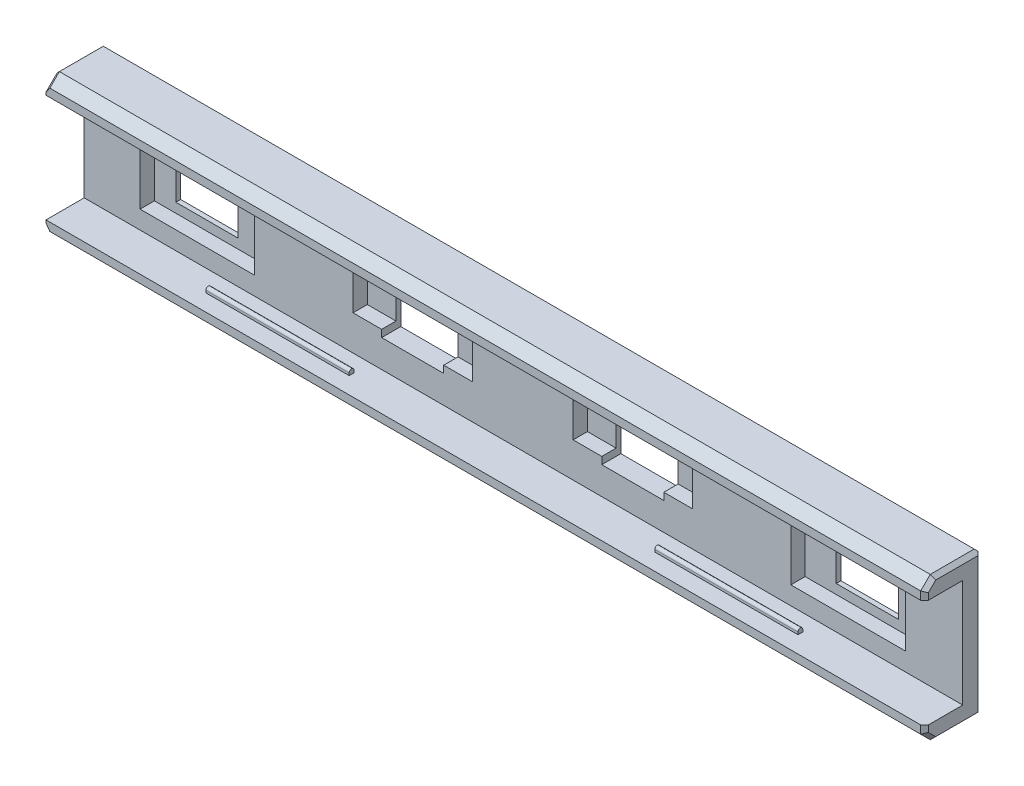
from build123d import *

# Parameters (mm, degrees)
SKETCH1_W               = 92
SKETCH1_H               = 15
BOSS_EXTRUDE1_DEPTH     = 6
CUT_EXTRUDE1_DEPTH      = 54.227863457
CUT_EXTRUDE1_DEPTH_BACK = 54.227863457
SKETCH2_W               = 6.5
SKETCH2_H               = 5.5
CUT_EXTRUDE2_DEPTH      = 54.227863457
CUT_EXTRUDE2_DEPTH_BACK = 54.227863457
SKETCH3_W               = 6.5
SKETCH3_H               = 5.5
CUT_EXTRUDE3_DEPTH      = 54.227863457
CUT_EXTRUDE3_DEPTH_BACK = 54.227863457
SKETCH4_W               = 6.5
SKETCH4_H               = 5.5
CUT_EXTRUDE4_DEPTH      = 54.227863457
CUT_EXTRUDE4_DEPTH_BACK = 54.227863457
SKETCH5_W               = 6.5
SKETCH5_H               = 5.5
CUT_EXTRUDE5_DEPTH      = 54.227863457
CUT_EXTRUDE5_DEPTH_BACK = 4
SKETCH8_W               = 92
SKETCH8_H               = 11.3
SKETCH9_W               = 12
SKETCH9_H               = 7.5
CUT_EXTRUDE6_DEPTH      = 1.5
SKETCH10_W              = 12.5
SKETCH10_H              = 4
CUT_EXTRUDE7_DEPTH      = 1.5
CUT_EXTRUDE8_DEPTH      = 92
SKETCH13_W              = 0.5
SKETCH13_H              = 10
CUT_EXTRUDE9_DEPTH      = 0.6
FILLET1_R               = 0.25
FILLET2_R               = 0.25
SKETCH16_W              = 15
SKETCH16_H              = 0.5
BOSS_EXTRUDE2_DEPTH     = 0.75
FILLET3_R               = 0.5
FILLET4_R               = 0.25
SKETCH17_W              = 15
SKETCH17_H              = 0.5
BOSS_EXTRUDE3_DEPTH     = 0.75
FILLET5_R               = 0.5
FILLET6_R               = 0.25
LPATTERN1_COUNT         = 2
LPATTERN1_PITCH         = 47
LPATTERN2_COUNT         = 2
LPATTERN2_PITCH         = 47
FILLET7_R               = 0.5
FILLET8_R               = 0.25
FILLET9_R               = 0.5
FILLET10_R              = 0.25
CHAMFER1_SIZE           = 0.4
CHAMFER2_SIZE           = 0.4
CHAMFER3_SIZE           = 0.4
CHAMFER4_SIZE           = 0.4
CHAMFER5_SIZE           = 0.4


# Some blends are built 0.0001 mm under size
with BuildPart() as part:
    # Sketch1 → Boss-Extrude1 (new body)
    with BuildSketch(Plane.XY):
        with Locations((0.25, 18.154296875)):
            Rectangle(SKETCH1_W, SKETCH1_H)
    extrude(amount=BOSS_EXTRUDE1_DEPTH)

    # Sketch2 → Cut-Extrude1 (cut, two sides: drawn at the far end of the back side and taken through both)
    with BuildSketch(Plane.XY.offset(6).offset(-CUT_EXTRUDE1_DEPTH_BACK)):
        with Locations((-34.4, 18.154296875)):
            Rectangle(SKETCH2_W, SKETCH2_H)
    extrude(amount=CUT_EXTRUDE1_DEPTH + CUT_EXTRUDE1_DEPTH_BACK, mode=Mode.SUBTRACT)

    # Sketch3 → Cut-Extrude2 (cut, two sides: drawn at the far end of the back side and taken through both)
    with BuildSketch(Plane.XY.offset(6).offset(-CUT_EXTRUDE2_DEPTH_BACK)):
        with Locations((-11.35, 18.154296875)):
            Rectangle(SKETCH3_W, SKETCH3_H)
    extrude(amount=CUT_EXTRUDE2_DEPTH + CUT_EXTRUDE2_DEPTH_BACK, mode=Mode.SUBTRACT)

    # Sketch4 → Cut-Extrude3 (cut, two sides: drawn at the far end of the back side and taken through both)
    with BuildSketch(Plane.XY.offset(6).offset(-CUT_EXTRUDE3_DEPTH_BACK)):
        with Locations((11.7, 18.154296875)):
            Rectangle(SKETCH4_W, SKETCH4_H)
    extrude(amount=CUT_EXTRUDE3_DEPTH + CUT_EXTRUDE3_DEPTH_BACK, mode=Mode.SUBTRACT)

    # Sketch5 → Cut-Extrude4 (cut, two sides: drawn at the far end of the back side and taken through both)
    with BuildSketch(Plane.XY.offset(6).offset(-CUT_EXTRUDE4_DEPTH_BACK)):
        with Locations((34.75, 18.154296875)):
            Rectangle(SKETCH5_W, SKETCH5_H)
    extrude(amount=CUT_EXTRUDE4_DEPTH + CUT_EXTRUDE4_DEPTH_BACK, mode=Mode.SUBTRACT)

    # Sketch8 → Cut-Extrude5 (cut, two sides: drawn at the far end of the back side and taken through both)
    with BuildSketch(Plane.XY.offset(6).offset(-CUT_EXTRUDE5_DEPTH_BACK)):
        with Locations((0.25, 18.154296875)):
            Rectangle(SKETCH8_W, SKETCH8_H)
    extrude(amount=CUT_EXTRUDE5_DEPTH + CUT_EXTRUDE5_DEPTH_BACK, mode=Mode.SUBTRACT)

    # Sketch9 → Cut-Extrude6 (cut)
    with BuildSketch(Plane.XY.offset(2)):
        with Locations((34.25, 18.154296875)):
            Rectangle(SKETCH9_W, SKETCH9_H)
        with Locations((-33.9, 18.154296875)):
            Rectangle(SKETCH9_W, SKETCH9_H)
    extrude(amount=-CUT_EXTRUDE6_DEPTH, mode=Mode.SUBTRACT)

    # Sketch10 → Cut-Extrude7 (cut)
    with BuildSketch(Plane.XY.offset(2)):
        with Locations((11.7, 18.154296875)):
            Rectangle(SKETCH10_W, SKETCH10_H)
        with Locations((-11.35, 18.154296875)):
            Rectangle(SKETCH10_W, SKETCH10_H)
    extrude(amount=-CUT_EXTRUDE7_DEPTH, mode=Mode.SUBTRACT)

    # Sketch12 → Cut-Extrude8 (cut)
    with BuildSketch(Plane(origin=(46.25, 0, 0), x_dir=(0, 0, -1), z_dir=(1, 0, 0))):
        Polygon((-6, 25.654296875), (-6, 24.654296875), (-5, 25.654296875), align=None)
        Polygon((-6, 10.654296875), (-5, 10.654296875), (-6, 11.654296875), align=None)
    extrude(amount=-CUT_EXTRUDE8_DEPTH, mode=Mode.SUBTRACT)

    # Sketch13 → Cut-Extrude9 (cut)
    with BuildSketch(Plane(origin=(0, 0, 0), x_dir=(-1, 0, 0), z_dir=(0, 0, -1))):
        with Locations((43.5, 18.154296875)):
            Rectangle(SKETCH13_W, SKETCH13_H)
    extrude(amount=-CUT_EXTRUDE9_DEPTH, mode=Mode.SUBTRACT)

    # Fillet1
    fillet1_edges = [part.edges().sort_by_distance(p)[0] for p in [
        (-43.75, 18.154296875, 0),
    ]]
    fillet(fillet1_edges, radius=FILLET1_R)

    # Fillet2
    fillet2_edges = [part.edges().sort_by_distance(p)[0] for p in [
        (-43.25, 18.154296875, 0.6),
        (-43.5, 23.154296875, 0.6),
        (-43.75, 18.154296875, 0.6),
        (-43.5, 13.154296875, 0.6),
    ]]
    fillet(fillet2_edges, radius=FILLET2_R - 0.0001)  # a hair under: the kernel refuses the full size

    # Sketch16 → Boss-Extrude2 (add)
    with BuildSketch(Plane.XZ.offset(-23.804296875)):
        with Locations((-23.25, 4)):
            Rectangle(SKETCH16_W, SKETCH16_H)
    boss_extrude2 = extrude(amount=BOSS_EXTRUDE2_DEPTH)

    # Fillet3
    fillet3_edges = [part.edges().sort_by_distance(p)[0] for p in [
        (-23.25, 23.054296875, 4.25),
    ]]
    fillet(fillet3_edges, radius=FILLET3_R - 0.0001)  # a hair under: the kernel refuses the full size

    # Fillet4
    # the kernel refuses this fillet: 0.25 mm, written as the material it takes off along each edge
    with BuildSketch(Plane(origin=(-32.517583767, 23.054296875, 3.75), x_dir=(0, 0.707033489959235, 0.7071800648180521), z_dir=(1, 0, 0))) as fillet4_piece_1:
        with BuildLine():
            CenterArc((0.530239774, -0.176759657), FILLET4_R, 44.994478066, 179.999583566)
            Line((0.353444757, -0.35351803), (0.335765256, -0.371193867))
            Line((0.335765256, -0.371193867), (-0.017679502, -0.017675837))
            Line((-0.017679502, -0.017675837), (-0.017675837, 0.017679502))
            ThreePointArc((-0.017675837, 0.017679502), (-0.017605119, 0.017750205), (0.724712878, 0.017675966))
            Line((0.724712878, 0.017675966), (0.707033505, 0))
        make_face()
    extrude(amount=18.535167534, mode=Mode.SUBTRACT)

    # Sketch17 → Boss-Extrude3 (add)
    with BuildSketch(Plane(origin=(0, 12.504296875, 0), x_dir=(1, 0, 0), z_dir=(0, 1, 0))):
        with Locations((-23.25, -4)):
            Rectangle(SKETCH17_W, SKETCH17_H)
    boss_extrude3 = extrude(amount=BOSS_EXTRUDE3_DEPTH)

    # Fillet5
    fillet5_edges = [part.edges().sort_by_distance(p)[0] for p in [
        (-23.25, 13.254296875, 4.25),
    ]]
    fillet(fillet5_edges, radius=FILLET5_R - 0.0001)  # a hair under: the kernel refuses the full size

    # Fillet6
    # the kernel refuses this fillet: 0.25 mm, written as the material it takes off along each edge
    with BuildSketch(Plane(origin=(-13.982416233, 13.254296875, 3.75), x_dir=(0, -0.7070334915471351, 0.7071800632304811), z_dir=(-1, 0, 0))) as fillet6_piece_1:
        with BuildLine():
            CenterArc((0.530239775, -0.176759657), FILLET6_R, 44.994477938, 179.999583823)
            Line((0.353444759, -0.35351803), (0.335765257, -0.371193867))
            Line((0.335765257, -0.371193867), (-0.017679502, -0.017675837))
            Line((-0.017679502, -0.017675837), (-0.017675837, 0.017679502))
            ThreePointArc((-0.017675837, 0.017679502), (-0.017605119, 0.017750205), (0.72471288, 0.017675966))
            Line((0.72471288, 0.017675966), (0.707033507, 0))
        make_face()
    extrude(amount=18.535167534, mode=Mode.SUBTRACT)

    # LPattern1: Boss-Extrude3 ×2
    with Locations(*[(i * LPATTERN1_PITCH, 0, 0) for i in range(1, LPATTERN1_COUNT)]):
        add(boss_extrude3)

    # LPattern2: Boss-Extrude2 ×2
    with Locations(*[(i * LPATTERN2_PITCH, 0, 0) for i in range(1, LPATTERN2_COUNT)]):
        add(boss_extrude2)

    # Fillet7
    fillet7_edges = [part.edges().sort_by_distance(p)[0] for p in [
        (23.75, 23.054296875, 4.25),
    ]]
    fillet(fillet7_edges, radius=FILLET7_R - 0.0001)  # a hair under: the kernel refuses the full size

    # Fillet8
    # the kernel refuses this fillet: 0.25 mm, written as the material it takes off along each edge
    with BuildSketch(Plane(origin=(14.482416233, 23.054296875, 3.75), x_dir=(0, 0.707033489959235, 0.7071800648180521), z_dir=(1, 0, 0))) as fillet8_piece_1:
        with BuildLine():
            CenterArc((0.530239774, -0.176759657), FILLET8_R, 44.994478066, 179.999583566)
            Line((0.353444757, -0.35351803), (0.335765256, -0.371193867))
            Line((0.335765256, -0.371193867), (-0.017679502, -0.017675837))
            Line((-0.017679502, -0.017675837), (-0.017675837, 0.017679502))
            ThreePointArc((-0.017675837, 0.017679502), (-0.017605119, 0.017750205), (0.724712878, 0.017675966))
            Line((0.724712878, 0.017675966), (0.707033505, 0))
        make_face()
    extrude(amount=18.535167534, mode=Mode.SUBTRACT)

    # Fillet9
    fillet9_edges = [part.edges().sort_by_distance(p)[0] for p in [
        (23.75, 13.254296875, 4.25),
    ]]
    fillet(fillet9_edges, radius=FILLET9_R - 0.0001)  # a hair under: the kernel refuses the full size

    # Fillet10
    # the kernel refuses this fillet: 0.25 mm, written as the material it takes off along each edge
    with BuildSketch(Plane(origin=(33.017583767, 13.254296875, 3.75), x_dir=(0, -0.7070334947010828, 0.707180060077187), z_dir=(-1, 0, 0))) as fillet10_piece_1:
        with BuildLine():
            CenterArc((0.530239777, -0.176759656), FILLET10_R, 44.994477682, 179.999584334)
            Line((0.353444762, -0.35351803), (0.335765261, -0.371193867))
            Line((0.335765261, -0.371193867), (-0.017679502, -0.017675837))
            Line((-0.017679502, -0.017675837), (-0.017675837, 0.017679502))
            ThreePointArc((-0.017675837, 0.017679502), (-0.017605119, 0.017750205), (0.724712883, 0.017675966))
            Line((0.724712883, 0.017675966), (0.70703351, 0))
        make_face()
    extrude(amount=18.535167534, mode=Mode.SUBTRACT)

    # Chamfer1
    chamfer1_edges = [part.edges().sort_by_distance(p)[0] for p in [
        (0.25, 25.654296875, 0),
        (0.25, 10.654296875, 0),
    ]]
    chamfer(chamfer1_edges, length=CHAMFER1_SIZE)

    # Chamfer2
    chamfer2_edges = [part.edges().sort_by_distance(p)[0] for p in [
        (46.25, 18.154296875, 0),
        (-45.75, 18.154296875, 0),
    ]]
    chamfer(chamfer2_edges, length=CHAMFER2_SIZE)

    # Chamfer3
    chamfer3_edges = [part.edges().sort_by_distance(p)[0] for p in [
        (-45.75, 25.654296875, 2.7),
        (-45.75, 10.654296875, 2.7),
    ]]
    chamfer(chamfer3_edges, length=CHAMFER3_SIZE)

    # Chamfer4
    chamfer4_edges = [part.edges().sort_by_distance(p)[0] for p in [
        (-45.75, 11.354296875, 5.7),
        (-45.75, 24.954296875, 5.7),
    ]]
    chamfer(chamfer4_edges, length=CHAMFER4_SIZE)

    # Chamfer5
    chamfer5_edges = [part.edges().sort_by_distance(p)[0] for p in [
        (46.25, 24.229296875, 6),
        (46.25, 25.654296875, 2.7),
        (46.25, 10.654296875, 2.7),
        (46.25, 12.079296875, 6),
        (46.25, 25.154296875, 5.5),
        (46.25, 11.154296875, 5.5),
    ]]
    chamfer(chamfer5_edges, length=CHAMFER5_SIZE)


solid = part.part
